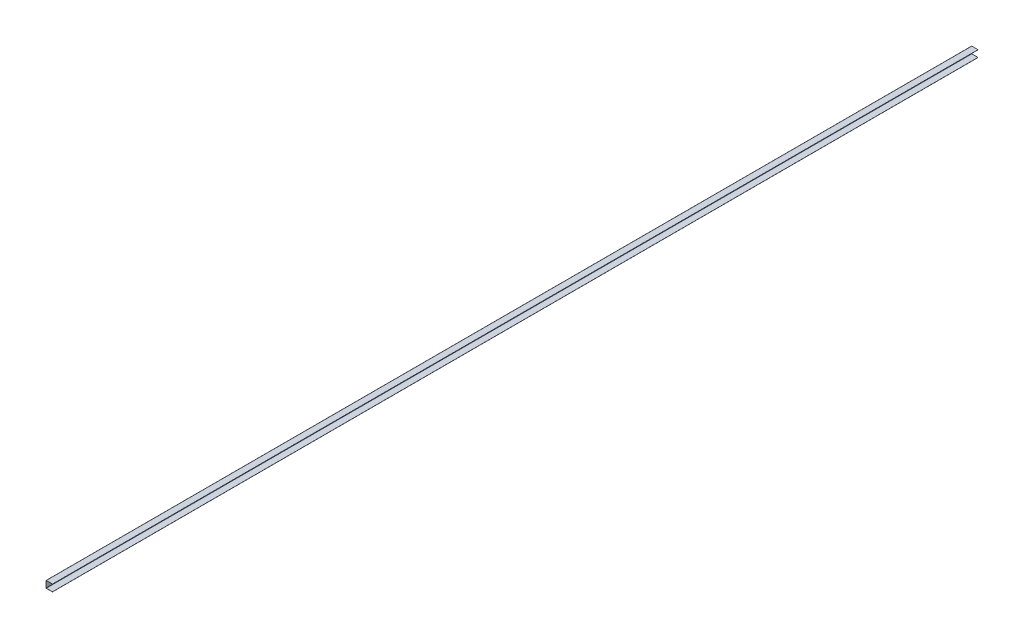
from build123d import *

# Parameters (mm, degrees)
SM_BASE_FLANGE_1_DEPTH = 3926


# Sheet-metal steps are written as plain solids
with BuildPart() as part:
    # Sketch 1 → Базовая кромка1 (new body)
    with BuildSketch(Plane.XY):
        with BuildLine():
            Line((27, 14), (0.75, 14))
            ThreePointArc((0.75, 14), (0.219669914, 13.780330086), (0, 13.25))
            Line((0, 13.25), (0, -13.25))
            ThreePointArc((0, -13.25), (0.219669914, -13.780330086), (0.75, -14))
            Line((0.75, -14), (27, -14))
            Line((27, -14), (27, -14.5))
            Line((27, -14.5), (0.75, -14.5))
            ThreePointArc((0.75, -14.5), (-0.133883476, -14.133883476), (-0.5, -13.25))
            Line((-0.5, -13.25), (-0.5, 13.25))
            ThreePointArc((-0.5, 13.25), (-0.133883476, 14.133883476), (0.75, 14.5))
            Line((0.75, 14.5), (27, 14.5))
            Line((27, 14.5), (27, 14))
        make_face()
    extrude(amount=-SM_BASE_FLANGE_1_DEPTH)


solid = part.part
